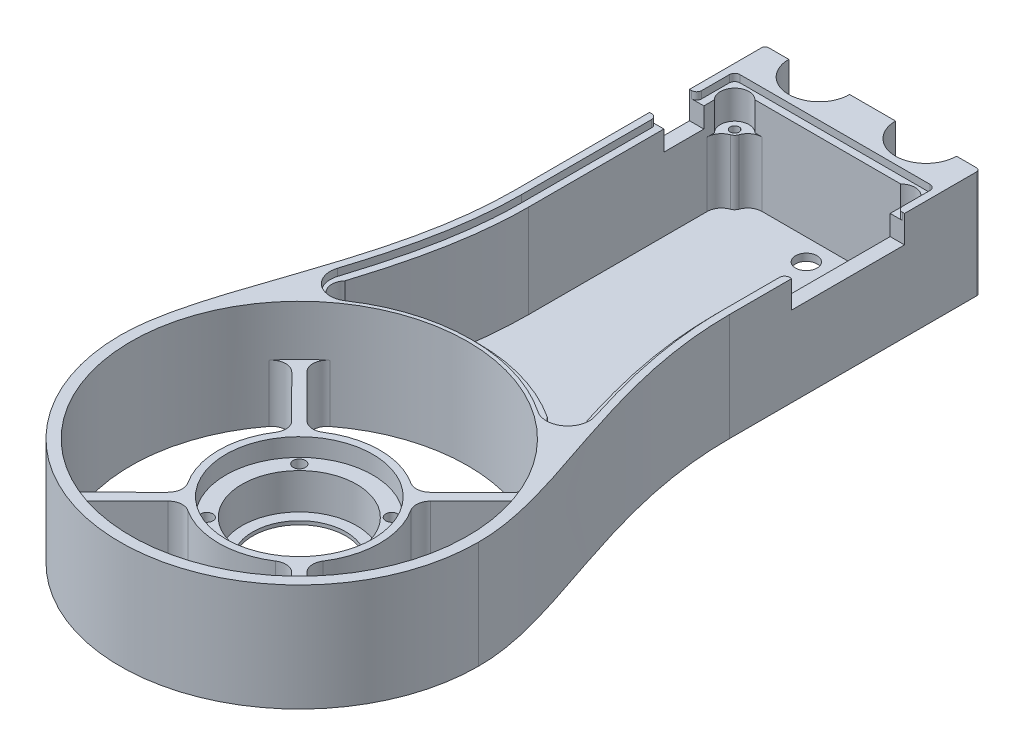
from build123d import *
from build123d.topology import SkipClean

# Parameters (mm, degrees)
EXTRUDE_1_DEPTH            = 30
CUT_EXTRUDE_1_DEPTH        = 209.327033807
SKETCH_3_R                 = 22.5
SKETCH_3_R_2               = 13
EXTRUDE_2_DEPTH            = 16
SKETCH_4_R                 = 20.5
CUT_EXTRUDE_2_DEPTH        = 5
SKETCH_5_R                 = 16
CUT_EXTRUDE_3_DEPTH        = 10
SKETCH_7_W                 = 1.7
SKETCH_7_H                 = 11
HOLE_WIZARD_M31_AT_2_COUNT = 2
HOLE_WIZARD_M31_AT_2_PITCH = 25.809397513
HOLE_WIZARD_M31_AT_3_COUNT = 2
HOLE_WIZARD_M31_AT_3_PITCH = 36.5
HOLE_WIZARD_M31_AT_4_COUNT = 2
HOLE_WIZARD_M31_AT_4_PITCH = 25.809397513
EXTRUDE_3_DEPTH            = 16
EXTRUDE_4_DEPTH            = 16
FILLET_1_R                 = 4
FILLET_2_R                 = 4
EXTRUDE_5_DEPTH            = 30
EXTRUDE_6_DEPTH            = 14
EXTRUDE_START              = -30
EXTRUDE_7_DEPTH            = 30
CUT_EXTRUDE_4_DEPTH        = 209.327033807
EXTRUDE_9_DEPTH            = 30
EXTRUDE_10_DEPTH           = 2
SKETCH_19_R                = 2.5
EXTRUDE_11_DEPTH           = 6
M3X0_51_D                  = 2.5
M3X0_51_DEPTH              = 5
M3X0_51_TIP                = 0.751075774
EXTRUDE_12_DEPTH           = 2
CUT_EXTRUDE_5_DEPTH        = 209.327033807
SKETCH_24_W                = 52
SKETCH_24_H                = 1.5
EXTRUDE_14_DEPTH           = 28
EXTRUDE_15_DEPTH           = 20
FILLET_3_R                 = 1
M4X0_71_D                  = 3.3
M4X0_71_DEPTH              = 11
M4X0_71_TIP                = 0.991420021
CUT_EXTRUDE_6_DEPTH        = 2
CUT_EXTRUDE_7_DEPTH        = 4
SKETCH_34_R                = 3
CUT_EXTRUDE_8_DEPTH        = 209.048439106
CUT_EXTRUDE_9_DEPTH        = 6
SKETCH_36_R                = 3
EXTRUDE_17_DEPTH           = 18
M3X0_52_D                  = 2.5
M3X0_52_DEPTH              = 8.5
M3X0_52_TIP                = 0.751075774
FILLET_4_R                 = 4
FILLET_START               = 1
FILLET_5_DEPTH             = 19
FILLET_6_R                 = 4
FILLET_7_DEPTH             = 19
FILLET_8_R                 = 4
SKETCH_39_R                = 3
CUT_EXTRUDE_10_DEPTH       = 209.048439106
CUT_EXTRUDE_12_DEPTH       = 2
FILLET_9_R                 = 1.5
CUT_EXTRUDE_13_REACH       = 210.327
SKETCH_44_W                = 11.16
SKETCH_44_H                = 7.6
FILLET_10_R                = 1.4
SKETCH_46_R                = 4
CUT_EXTRUDE_14_DEPTH       = 8


with BuildPart() as part:
    # Эскиз1 → Бобышка-Вытянуть1 (new body)
    with BuildSketch(Plane(origin=(0, 0, 0), x_dir=(1, 0, 0), z_dir=(0, 1, 0))):
        with BuildLine():
            Line((0, 0), (8.1, 0))
            ThreePointArc((8.1, 0), (15.1, -7), (22.1, 0))
            Line((22.1, 0), (37.9, 0))
            ThreePointArc((37.9, 0), (44.9, -7), (51.9, 0))
            Line((51.9, 0), (60, 0))
            Line((60, 0), (60, -50))
            add(Edge.make_bspline(
                [(60, -50), (60, -86.116353651), (80.160728995, -116.642608399), (80, -140)],
                knots=[0, 0, 0, 0, 1, 1, 1, 1], degree=3))
            ThreePointArc((80, -140), (30, -190), (-20, -140))
            add(Edge.make_bspline(
                [(0, -50), (0, -86.116353651), (-20.160728995, -116.642608399), (-20, -140)],
                knots=[0, 0, 0, 0, 1, 1, 1, 1], degree=3))
            Line((0, -50), (0, 0))
        make_face()
    extrude(amount=EXTRUDE_1_DEPTH)

    # Эскиз2 → Вырез-Вытянуть1 (cut, through all)
    with BuildSketch(Plane.XZ):
        with BuildLine():
            Line((3, 50), (3, 3))
            Line((3, 3), (5.560607986, 3))
            ThreePointArc((5.560607986, 3), (15.1, 10), (24.639392014, 3))
            Line((24.639392014, 3), (35.360607986, 3))
            ThreePointArc((35.360607986, 3), (44.9, 10), (54.439392014, 3))
            Line((54.439392014, 3), (57, 3))
            Line((57, 3), (57, 50))
            add(Edge.make_bspline(
                [(57, 50), (57, 51.157619484), (57.040607312, 53.481441414), (57.273709046, 58.05633088), (57.830062064, 63.685752057), (58.858254923, 70.27885976), (60.625878255, 78.854729592), (63.422502325, 89.162823296), (67.223452697, 100.856761308), (70.982787265, 111.851189123), (73.680425705, 120.399524986), (75.344386592, 126.838965256), (76.290218779, 131.460253347), (76.783421903, 135.123225854), (76.977758529, 137.948366969), (77.004903817, 139.304391304), (76.999998858, 139.989637546)],
                knots=[0, 0, 0, 0, 0.031254955, 0.062509911, 0.125019821, 0.187529732, 0.250039643, 0.375059464, 0.500079285, 0.625099107, 0.750118928, 0.812628839, 0.875138749, 0.93764866, 0.968903615, 1.000158571, 1.000158571, 1.000158571, 1.000158571], degree=3))
            ThreePointArc((76.999998858, 139.989637546), (30, 187), (-16.999998858, 139.989637546))
            add(Edge.make_bspline(
                [(-16.999998858, 139.989637546), (-17.004903817, 139.304391304), (-16.977758529, 137.948366969), (-16.783421903, 135.123225854), (-16.29021878, 131.460253347), (-15.344386592, 126.838965256), (-13.680425705, 120.399524986), (-10.982787266, 111.851189124), (-7.223452697, 100.856761308), (-3.422502325, 89.162823296), (-0.625878255, 78.854729592), (1.141745077, 70.27885976), (2.169937936, 63.685752057), (2.726290954, 58.05633088), (2.959392688, 53.481441414), (3, 51.157619484), (3, 50)],
                knots=[-0.000158571, -0.000158571, -0.000158571, -0.000158571, 0.031096385, 0.06235134, 0.124861251, 0.187371161, 0.249881072, 0.374900893, 0.499920715, 0.624940536, 0.749960357, 0.812470268, 0.874980179, 0.937490089, 0.968745045, 1, 1, 1, 1], degree=3))
        make_face()
    extrude(amount=-CUT_EXTRUDE_1_DEPTH, mode=Mode.SUBTRACT)

    # Эскиз9 → Бобышка-Вытянуть3 (add)
    with SkipClean():  # the faces are left unmerged after this step: merging them gives an invalid solid
        with BuildSketch(Plane.XZ):
            with BuildLine():
                ThreePointArc((-10.590299411, 110.803636994), (30, 89.99999981), (70.590299411, 110.803636994))
                add(Edge.make_bspline(
                    [(70.590299411, 110.803636994), (70.692739705, 111.112829984), (71.968212028, 114.973824728), (73.680425705, 120.399524986), (75.344386592, 126.838965256), (76.290218779, 131.460253347), (76.783421903, 135.123225854), (76.977758529, 137.948366969), (77.004903817, 139.304391304), (76.999998858, 139.989637546)],
                    knots=[0.614251023, 0.614251023, 0.614251023, 0.614251023, 0.625099107, 0.750118928, 0.812628839, 0.875138749, 0.93764866, 0.968903615, 1.000158571, 1.000158571, 1.000158571, 1.000158571], degree=3))
                ThreePointArc((76.999998858, 139.989637546), (30, 93), (-16.999998858, 139.989637546))
                add(Edge.make_bspline(
                    [(-16.999998858, 139.989637546), (-17.004903817, 139.304391304), (-16.977758529, 137.948366969), (-16.783421903, 135.123225854), (-16.29021878, 131.460253347), (-15.344386592, 126.838965256), (-13.680425705, 120.399524986), (-11.968212028, 114.973824728), (-10.692739705, 111.112829984), (-10.590299411, 110.803636994)],
                    knots=[-0.000158571, -0.000158571, -0.000158571, -0.000158571, 0.031096385, 0.06235134, 0.124861251, 0.187371161, 0.249881072, 0.374900893, 0.385748977, 0.385748977, 0.385748977, 0.385748977], degree=3))
            make_face()
        extrude(amount=-EXTRUDE_3_DEPTH)



with BuildPart() as body_2:
    # Эскиз3 → Бобышка-Вытянуть2 (new body)
    with BuildSketch(Plane.XZ):
        with Locations(Location((30, 140, 0), (0, 0, 270))):
            Circle(SKETCH_3_R)
        with Locations(Location((30, 140, 0), (0, 0, 270))):
            Circle(SKETCH_3_R_2, mode=Mode.SUBTRACT)
    extrude(amount=-EXTRUDE_2_DEPTH)

    # Эскиз4 → Вырез-Вытянуть2 (cut)
    with BuildSketch(Plane(origin=(0, 16, 0), x_dir=(1, 0, 0), z_dir=(0, 1, 0))):
        with Locations(Location((30, -140, 0), (0, 0, 270))):
            Circle(SKETCH_4_R)
    extrude(amount=-CUT_EXTRUDE_2_DEPTH, mode=Mode.SUBTRACT)

    # Эскиз5 → Вырез-Вытянуть3 (cut)
    with BuildSketch(Plane(origin=(0, 11, 0), x_dir=(1, 0, 0), z_dir=(0, 1, 0))):
        with Locations(Location((30, -140, 0), (0, 0, 270))):
            Circle(SKETCH_5_R)
    extrude(amount=-CUT_EXTRUDE_3_DEPTH, mode=Mode.SUBTRACT)

    # Эскиз7 → Отверстие с зазором M31 (revolve, cut)
    with BuildSketch(Plane(origin=(17.095301243, 11, 127.095301243), x_dir=(0, 0, 1), z_dir=(1, 0, 0))):
        with Locations((0.85, 5.5)):
            Rectangle(SKETCH_7_W, SKETCH_7_H)
    hole_wizard_m31 = revolve(axis=Axis((17.095301243, 17.35, 127.095301243), (0, -1, 0)), mode=Mode.SUBTRACT)

    # Отверстие с зазором M31 at 2: Отверстие с зазором M31 ×2
    with Locations(*[(i * HOLE_WIZARD_M31_AT_2_PITCH, 0, 0) for i in range(1, HOLE_WIZARD_M31_AT_2_COUNT)]):
        add(hole_wizard_m31, mode=Mode.SUBTRACT)

    # Отверстие с зазором M31 at 3: Отверстие с зазором M31 ×2
    with Locations(*[Vector(0.7071067811865477, 0, 0.7071067811865475) * (i * HOLE_WIZARD_M31_AT_3_PITCH) for i in range(1, HOLE_WIZARD_M31_AT_3_COUNT)]):
        add(hole_wizard_m31, mode=Mode.SUBTRACT)

    # Отверстие с зазором M31 at 4: Отверстие с зазором M31 ×2
    with Locations(*[(0, 0, i * HOLE_WIZARD_M31_AT_4_PITCH) for i in range(1, HOLE_WIZARD_M31_AT_4_COUNT)]):
        add(hole_wizard_m31, mode=Mode.SUBTRACT)


with BuildPart() as part_1:
    with SkipClean():  # the faces are left unmerged after this step: merging them gives an invalid solid
        add(part.part)

        add(body_2.part)  # Бобышка-Вытянуть4 merges body 2
        # Эскиз10 → Бобышка-Вытянуть4 (add)
        with BuildSketch(Plane.XZ):
            with BuildLine():
                Line((13.06156625, 154.810113507), (-4.284838091, 172.148870541))
                ThreePointArc((-4.284838091, 172.148870541), (-3.241274471, 173.226761376), (-2.163839457, 174.270795605))
                Line((-2.163839457, 174.270795605), (15.182490994, 156.931964648))
                ThreePointArc((15.182490994, 156.931964648), (14.086623923, 155.906428318), (13.06156625, 154.810113507))
            make_face()
            with BuildLine():
                Line((15.189886493, 123.06156625), (-2.148870541, 105.715161909))
                ThreePointArc((-2.148870541, 105.715161909), (-3.226761376, 106.758725529), (-4.270795605, 107.836160543))
                Line((-4.270795605, 107.836160543), (13.068035352, 125.182490994))
                ThreePointArc((13.068035352, 125.182490994), (14.093571682, 124.086623923), (15.189886493, 123.06156625))
            make_face()
            with BuildLine():
                Line((44.810113507, 156.93843375), (62.148870541, 174.284838091))
                ThreePointArc((62.148870541, 174.284838091), (63.226761376, 173.241274471), (64.270795605, 172.163839457))
                Line((64.270795605, 172.163839457), (46.931964648, 154.817509006))
                ThreePointArc((46.931964648, 154.817509006), (45.906428318, 155.913376077), (44.810113507, 156.93843375))
            make_face()
            with BuildLine():
                Line((46.93843375, 125.189886493), (64.284838091, 107.851129459))
                ThreePointArc((64.284838091, 107.851129459), (63.241274471, 106.773238624), (62.163839457, 105.729204395))
                Line((62.163839457, 105.729204395), (44.817509006, 123.068035352))
                ThreePointArc((44.817509006, 123.068035352), (45.913376077, 124.093571682), (46.93843375, 125.189886493))
            make_face()
        extrude(amount=-EXTRUDE_4_DEPTH)

    # Скругление1
    fillet_1_edges = [part_1.edges().sort_by_distance(p)[0] for p in [
        (70.590299411, 8, 110.803636994),
        (-10.590299411, 8, 110.803636994),
    ]]
    fillet(fillet_1_edges, radius=FILLET_1_R)

    # Скругление2
    fillet_2_edges = [part_1.edges().sort_by_distance(p)[0] for p in [
        (13.068035352, 8, 125.182490994),
        (-4.270795605, 8, 107.836160543),
        (13.06156625, 8, 154.810113507),
        (-4.284838091, 8, 172.148870541),
        (-2.163839457, 8, 174.270795605),
        (15.182490994, 8, 156.931964648),
        (44.810113507, 8, 156.93843375),
        (62.148870541, 8, 174.284838091),
        (46.931964648, 8, 154.817509006),
        (64.270795605, 8, 172.163839457),
        (46.93843375, 8, 125.189886493),
        (64.284838091, 8, 107.851129459),
        (44.817509006, 8, 123.068035352),
        (15.189886493, 8, 123.06156625),
        (-2.148870541, 8, 105.715161909),
        (62.163839457, 8, 105.729204395),
    ]]
    fillet(fillet_2_edges, radius=FILLET_2_R)

    # Эскиз11 → Бобышка-Вытянуть5 (add, through all)
    with BuildSketch(Plane(origin=(0, 30, 0), x_dir=(1, 0, 0), z_dir=(0, 1, 0))):
        with BuildLine():
            ThreePointArc((24.639392014, -3), (21.016079756, -8.062257768), (15.099999933, -10))
            Line((15.099999933, -10), (44.900000016, -10))
            ThreePointArc((44.900000016, -10), (38.983920224, -8.062257753), (35.360607986, -3))
            Line((35.360607986, -3), (24.639392014, -3))
        make_face()
        with BuildLine():
            ThreePointArc((54.439392014, -3), (50.81607979, -8.062257743), (44.900000016, -10))
            Line((44.900000016, -10), (57, -10))
            Line((57, -10), (57, -3))
            Line((57, -3), (54.439392014, -3))
        make_face()
        with BuildLine():
            Line((3, -3), (3, -10))
            Line((3, -10), (15.099999933, -10))
            ThreePointArc((15.099999933, -10), (9.18392019, -8.062257728), (5.560607986, -3))
            Line((5.560607986, -3), (3, -3))
        make_face()
    extrude(amount=-EXTRUDE_5_DEPTH)

    # Эскиз12 → Бобышка-Вытянуть6 (add)
    with SkipClean():  # the faces are left unmerged after this step: merging them gives an invalid solid
        with BuildSketch(Plane(origin=(0, 16, 0), x_dir=(1, 0, 0), z_dir=(0, 1, 0))):
            with BuildLine():
                ThreePointArc((59.169351437, -99.390284958), (30, -89.99999981), (0.830648563, -99.390284958))
                ThreePointArc((0.830648563, -99.390284958), (-3.85522263, -99.376716586), (-5.312887214, -94.923314864))
                add(Edge.make_bspline(
                    [(-5.312887214, -94.923314864), (-5.94223774, -96.891654802), (-7.843811242, -102.671041765), (-10.982787266, -111.851189124), (-13.680425705, -120.399524986), (-15.344386592, -126.838965256), (-16.29021878, -131.460253347), (-16.783421903, -135.123225854), (-16.977758529, -137.948366969), (-17.004903817, -139.304391304), (-16.999998858, -139.989637546)],
                    knots=[-0.000158571, -0.000158571, -0.000158571, -0.000158571, 0.062969621, 0.187989442, 0.313009264, 0.375519174, 0.438029085, 0.500538996, 0.531793951, 0.563048906, 0.563048906, 0.563048906, 0.563048906], degree=3))
                ThreePointArc((-16.999998858, -139.989637546), (30, -93), (76.999998858, -139.989637546))
                add(Edge.make_bspline(
                    [(76.999998858, -139.989637546), (77.004903817, -139.304391304), (76.977758529, -137.948366969), (76.783421903, -135.123225854), (76.290218779, -131.460253347), (75.344386592, -126.838965256), (73.680425705, -120.399524986), (70.982787265, -111.851189123), (67.843811241, -102.671041765), (65.94223774, -96.891654802), (65.312887214, -94.923314864)],
                    knots=[0.436951094, 0.436951094, 0.436951094, 0.436951094, 0.468206049, 0.499461004, 0.561970915, 0.624480826, 0.686990736, 0.812010558, 0.937030379, 1.000158571, 1.000158571, 1.000158571, 1.000158571], degree=3))
                ThreePointArc((65.312887214, -94.923314864), (63.85522263, -99.376716586), (59.169351437, -99.390284958))
            make_face()
        extrude(amount=EXTRUDE_6_DEPTH)
    add(part_1.part.scale(1), mode=Mode.REPLACE)  # the faces are merged on a copy

    # Эскиз13 → Бобышка-Вытянуть7 (add)
    with BuildSketch(Plane(origin=(0, 30, 0), x_dir=(1, 0, 0), z_dir=(0, 1, 0)).offset(EXTRUDE_START)):
        with BuildLine():
            Line((4, -50), (4, -11))
            Line((4, -11), (56, -11))
            Line((56, -11), (56, -50))
            add(Edge.make_bspline(
                [(56, -50), (56, -52.034980681), (56.125270586, -56.131935358), (56.819212399, -64.088500397), (58.410810449, -73.747778237), (60.678363501, -82.951847558), (62.737499644, -90.067621054), (63.80856927, -93.502002348), (64.360390296, -95.22786309)],
                knots=[0, 0, 0, 0, 0.054618887, 0.109237773, 0.218475547, 0.32771332, 0.382332207, 0.436951094, 0.436951094, 0.436951094, 0.436951094], degree=3))
            Line((64.360390296, -95.22786309), (65.166149164, -97.747933059))
            ThreePointArc((65.166149164, -97.747933059), (65.497512903, -96.349026708), (65.312887214, -94.923314864))
            add(Edge.make_bspline(
                [(57, -50), (57, -51.157619484), (57.040607312, -53.481441414), (57.273709046, -58.05633088), (57.830062064, -63.685752057), (58.858254923, -70.27885976), (60.625878255, -78.854729592), (62.85764527, -87.080813237), (64.695864475, -92.993530982), (65.312887214, -94.923314864)],
                knots=[0, 0, 0, 0, 0.031254955, 0.062509911, 0.125019821, 0.187529732, 0.250039643, 0.375059464, 0.436951094, 0.436951094, 0.436951094, 0.436951094], degree=3))
            Line((57, -50), (57, -10))
            Line((57, -10), (3, -10))
            Line((3, -10), (3, -50))
            add(Edge.make_bspline(
                [(-5.312887214, -94.923314864), (-4.695864475, -92.993530982), (-2.85764527, -87.080813237), (-0.625878255, -78.854729592), (1.141745077, -70.27885976), (2.169937936, -63.685752057), (2.726290954, -58.05633088), (2.959392688, -53.481441414), (3, -51.157619484), (3, -50)],
                knots=[0.563048906, 0.563048906, 0.563048906, 0.563048906, 0.624940536, 0.749960357, 0.812470268, 0.874980179, 0.937490089, 0.968745045, 1, 1, 1, 1], degree=3))
            ThreePointArc((-5.312887214, -94.923314864), (-5.497512903, -96.349026708), (-5.166149164, -97.747933059))
            Line((-5.166149164, -97.747933059), (-4.360390296, -95.22786309))
            add(Edge.make_bspline(
                [(-4.360390296, -95.22786309), (-3.80856927, -93.502002348), (-2.737499644, -90.067621054), (-0.678363501, -82.951847558), (1.589189551, -73.747778237), (3.180787601, -64.088500397), (3.874729414, -56.131935358), (4, -52.034980681), (4, -50)],
                knots=[0.563048906, 0.563048906, 0.563048906, 0.563048906, 0.617667793, 0.67228668, 0.781524453, 0.890762227, 0.945381113, 1, 1, 1, 1], degree=3))
        make_face()
    extrude(amount=EXTRUDE_7_DEPTH)

    # Эскиз14 → Вырез-Вытянуть4 (cut, through all)
    with BuildSketch(Plane(origin=(0, 30, 0), x_dir=(1, 0, 0), z_dir=(0, 1, 0))):
        with BuildLine():
            Line((4, -50), (56, -50))
            add(Edge.make_bspline(
                [(56, -50), (56, -52.034980681), (56.125270586, -56.131935358), (56.819212399, -64.088500397), (58.410810449, -73.747778237), (60.678363501, -82.951847558), (62.737499644, -90.067621054), (63.80856927, -93.502002348), (64.360390296, -95.22786309)],
                knots=[0, 0, 0, 0, 0.054618887, 0.109237773, 0.218475547, 0.32771332, 0.382332207, 0.436951094, 0.436951094, 0.436951094, 0.436951094], degree=3))
            Line((64.360390296, -95.22786309), (68.459948644, -108.049532565))
            ThreePointArc((68.459948644, -108.049532565), (30, -89.99999981), (-8.459948644, -108.049532565))
            Line((-8.459948644, -108.049532565), (-4.360390296, -95.22786309))
            add(Edge.make_bspline(
                [(-4.360390296, -95.22786309), (-3.80856927, -93.502002348), (-2.737499644, -90.067621054), (-0.678363501, -82.951847558), (1.589189551, -73.747778237), (3.180787601, -64.088500397), (3.874729414, -56.131935358), (4, -52.034980681), (4, -50)],
                knots=[0.563048906, 0.563048906, 0.563048906, 0.563048906, 0.617667793, 0.67228668, 0.781524453, 0.890762227, 0.945381113, 1, 1, 1, 1], degree=3))
        make_face()
    extrude(amount=-CUT_EXTRUDE_4_DEPTH, mode=Mode.SUBTRACT)

    # Эскиз15 → Бобышка-Вытянуть9 (add)
    with BuildSketch(Plane(origin=(0, 30, 0), x_dir=(1, 0, 0), z_dir=(0, 1, 0))):
        with BuildLine():
            Line((-4.360390296, -95.22786309), (-8.459948644, -108.049532565))
            ThreePointArc((-8.459948644, -108.049532565), (-3.531205401, -102.910132335), (2.077630415, -98.523002811))
            ThreePointArc((2.077630415, -98.523002811), (-2.535344593, -98.420348423), (-3.982504348, -94.039046676))
            add(Edge.make_bspline(
                [(-4.360390296, -95.22786309), (-4.233592317, -94.831293107), (-4.107654238, -94.435180898), (-3.982504348, -94.039046676)],
                knots=[0.563048906, 0.563048906, 0.563048906, 0.563048906, 0.575599288, 0.575599288, 0.575599288, 0.575599288], degree=3))
        make_face()
        with BuildLine():
            Line((68.459948644, -108.049532565), (64.360390296, -95.22786309))
            add(Edge.make_bspline(
                [(63.982538134, -94.03915362), (64.107676904, -94.43525219), (64.233603727, -94.831328794), (64.360390296, -95.22786309)],
                knots=[0.424401841, 0.424401841, 0.424401841, 0.424401841, 0.436951094, 0.436951094, 0.436951094, 0.436951094], degree=3))
            ThreePointArc((63.982538134, -94.03915362), (62.53530146, -98.420382479), (57.922370807, -98.523003634))
            ThreePointArc((57.922370807, -98.523003634), (63.531205947, -102.910132829), (68.459948644, -108.049532565))
        make_face()
    extrude(amount=-EXTRUDE_9_DEPTH)

    # Эскиз16 → Бобышка-Вытянуть10 (add)
    with BuildSketch(Plane.XZ):
        Polygon((-7.852464766, 101.935174027), (-2.068237999, 81.427460947), (2.401391775, 58.816392678), (2.401391775, 39.097437793), (2.401391775, 22.533515689), (2.401391775, 9.387545766), (57.351546055, 9.387545766), (57.351546055, 36.731163207), (57.351546055, 56.975956889), (62.609934024, 81.427460947), (67.020194902, 101.935174027), (62.609934024, 101.935174027), (57.351546055, 100.895725243), (53.104612881, 97.852307048), (47.493444526, 95.406397044), (40.928616834, 92.544786642), (34.931301468, 92.544786642), (28.840892836, 91.340868656), (21.733587887, 92.869321333), (13.415834781, 94.658085442), (5.092688812, 97.852307048), (-1.046943422, 101.935174027), align=None)
    extrude(amount=-EXTRUDE_10_DEPTH)

    # Эскиз19 → Бобышка-Вытянуть11 (add)
    with BuildSketch(Plane(origin=(0, 2, 0), x_dir=(1, 0, 0), z_dir=(0, 1, 0))):
        with Locations(Location((7.5, -18.5, 0), (0, 0, 90))):
            Circle(SKETCH_19_R)
        with Locations(Location((52.5, -18.5, 0), (0, 0, 90))):
            Circle(SKETCH_19_R)
        with Locations(Location((52.5, -63.5, 0), (0, 0, 90))):
            Circle(SKETCH_19_R)
        with Locations(Location((7.5, -63.5, 0), (0, 0, 90))):
            Circle(SKETCH_19_R)
    extrude(amount=EXTRUDE_11_DEPTH)

    # Отверстие обработанное метчиком M3x0.51
    with Locations(Plane(origin=(0, 8, 0), x_dir=(1, 0, 0), z_dir=(0, 1, 0))):
        with Locations((7.5, -18.5), (52.5, -18.5), (52.5, -63.5), (7.5, -63.5)):
            Hole(M3X0_51_D / 2, depth=M3X0_51_DEPTH)
            with Locations((0, 0, -(M3X0_51_DEPTH + M3X0_51_TIP / 2))):  # 118° drill point
                Cone(0, M3X0_51_D / 2, M3X0_51_TIP, mode=Mode.SUBTRACT)

    # Эскиз22 → Бобышка-Вытянуть12 (add)
    with BuildSketch(Plane(origin=(0, 2, 0), x_dir=(1, 0, 0), z_dir=(0, 1, 0))):
        with BuildLine():
            ThreePointArc((9.974873734, -18.853553391), (9.267766953, -20.267766953), (7.853553391, -20.974873734))
            Line((7.853553391, -20.974873734), (27.878679656, -41))
            Line((27.878679656, -41), (7.853553391, -61.025126266))
            ThreePointArc((7.853553391, -61.025126266), (9.267766953, -61.732233047), (9.974873734, -63.146446609))
            Line((9.974873734, -63.146446609), (30, -43.121320344))
            Line((30, -43.121320344), (50.025126266, -63.146446609))
            ThreePointArc((50.025126266, -63.146446609), (50.732233047, -61.732233047), (52.146446609, -61.025126266))
            Line((52.146446609, -61.025126266), (32.121320344, -41))
            Line((32.121320344, -41), (52.146446609, -20.974873734))
            ThreePointArc((52.146446609, -20.974873734), (50.732233047, -20.267766953), (50.025126266, -18.853553391))
            Line((50.025126266, -18.853553391), (30, -38.878679656))
            Line((30, -38.878679656), (9.974873734, -18.853553391))
        make_face()
        with BuildLine():
            Line((4, -20), (5.5, -20))
            ThreePointArc((5.5, -20), (5, -18.5), (5.5, -17))
            Line((5.5, -17), (4, -17))
            Line((4, -17), (4, -20))
        make_face()
        with BuildLine():
            ThreePointArc((5.5, -65), (5, -63.5), (5.5, -62))
            Line((5.5, -62), (3.315002208, -62))
            add(Edge.make_bspline(
                [(2.940902429, -65), (3.073908034, -64.031610352), (3.199237612, -63.031667865), (3.31200872, -62.026758174), (3.315002208, -62)],
                knots=[0.863646764, 0.863646764, 0.863646764, 0.863646764, 0.890762227, 0.891503892, 0.891503892, 0.891503892, 0.891503892], degree=3))
            Line((2.940902429, -65), (5.5, -65))
        make_face()
        with BuildLine():
            Line((56, -17), (54.5, -17))
            ThreePointArc((54.5, -17), (55, -18.5), (54.5, -20))
            Line((54.5, -20), (56, -20))
            Line((56, -20), (56, -17))
        make_face()
        with BuildLine():
            ThreePointArc((54.5, -62), (55, -63.5), (54.5, -65))
            Line((54.5, -65), (57.059097571, -65))
            add(Edge.make_bspline(
                [(56.684997792, -62), (56.68799128, -62.026758174), (56.800762388, -63.031667865), (56.926091965, -64.031610352), (57.059097571, -65)],
                knots=[0.108496108, 0.108496108, 0.108496108, 0.108496108, 0.109237773, 0.136353236, 0.136353236, 0.136353236, 0.136353236], degree=3))
            Line((56.684997792, -62), (54.5, -62))
        make_face()
    extrude(amount=EXTRUDE_12_DEPTH)

    # Эскиз23 → Вырез-Вытянуть5 (cut, through all)
    with BuildSketch(Plane(origin=(0, 30, 0), x_dir=(1, 0, 0), z_dir=(0, 1, 0))):
        with BuildLine():
            Line((8.1, 0), (6.6, 0))
            ThreePointArc((6.6, 0), (15.1, -8.5), (23.6, 0))
            Line((23.6, 0), (22.1, 0))
            ThreePointArc((22.1, 0), (15.1, -7), (8.1, 0))
        make_face()
        with BuildLine():
            Line((53.4, 0), (51.9, 0))
            ThreePointArc((51.9, 0), (44.9, -7), (37.9, 0))
            Line((37.9, 0), (36.4, 0))
            ThreePointArc((36.4, 0), (44.9, -8.5), (53.4, 0))
        make_face()
    extrude(amount=-CUT_EXTRUDE_5_DEPTH, mode=Mode.SUBTRACT)

    # Эскиз24 → Бобышка-Вытянуть14 (add)
    with BuildSketch(Plane(origin=(0, 2, 0), x_dir=(1, 0, 0), z_dir=(0, 1, 0))):
        with Locations((30, -11.75)):
            Rectangle(SKETCH_24_W, SKETCH_24_H)
    extrude(amount=EXTRUDE_14_DEPTH)


with BuildPart() as body_2_2:
    # Split Bodies 1: the piece on the far side of the plane
    add(part_1.part)
    split(bisect_by=Plane(origin=(0, 0, 41.123183465), x_dir=(-1, 0, 0), z_dir=(0, 0, -1)), keep=Keep.BOTTOM)


with BuildPart() as part_2:
    add(part_1.part)

    # Split Bodies 1
    split(bisect_by=Plane(origin=(0, 0, 41.123183465), x_dir=(-1, 0, 0), z_dir=(0, 0, -1)), keep=Keep.TOP)


with BuildPart() as part_3:
    # Move Body 1: read off the stored shape, not the designer's step
    # Move Body 1: moved
    add(part_2.part.moved(Location((0, 0, -20))))


    add(body_2_2.part)  # Бобышка-Вытянуть15 merges body 2 2
    # Эскиз27 → Бобышка-Вытянуть15 (add)
    with BuildSketch(Plane(origin=(0, 0, 41.123183465), x_dir=(-1, 0, 0), z_dir=(0, 0, -1))):
        Polygon((-60, 0), (0, 0), (0, 30), (-4, 30), (-4, 2), (-56, 2), (-56, 30), (-60, 30), align=None)
    extrude(amount=EXTRUDE_15_DEPTH)

    # Скругление3
    fillet_3_edges = [part_3.edges().sort_by_distance(p)[0] for p in [
        (0, 15, -20),
        (60, 15, -20),
    ]]
    fillet(fillet_3_edges, radius=FILLET_3_R)

    # Отверстие обработанное метчиком M4x0.71
    with Locations(Plane(origin=(0, 0, -20), x_dir=(-1, 0, 0), z_dir=(0, 0, -1))):
        with Locations((-55.75, 25), (-30, 25), (-4.25, 25), (-4.25, 5), (-30, 5), (-55.75, 5)):
            Hole(M4X0_71_D / 2, depth=M4X0_71_DEPTH)
            with Locations((0, 0, -(M4X0_71_DEPTH + M4X0_71_TIP / 2))):  # 118° drill point
                Cone(0, M4X0_71_D / 2, M4X0_71_TIP, mode=Mode.SUBTRACT)

    # Эскиз31 → Вырез-Вытянуть6 (cut)
    with BuildSketch(Plane(origin=(0, 30, 0), x_dir=(1, 0, 0), z_dir=(0, 1, 0))):
        with BuildLine():
            Line((58, -50), (58, 9.5))
            Line((58, 9.5), (2, 9.5))
            Line((2, 9.5), (2, -50))
            add(Edge.make_bspline(
                [(2, -50), (2, -53.699300475), (1.793050573, -57.386405136), (1.211129131, -62.901062421), (0.97232817, -64.735113189), (0.414928411, -68.387396341), (0.096175926, -70.206931321), (-0.612795733, -73.834212995), (-1.003172031, -75.642278607), (-1.844400633, -79.239733159), (-2.295455623, -81.030251086), (-3.724777276, -86.381266668), (-4.779021803, -89.921274352), (-5.892373376, -93.445341845)],
                knots=[0, 0, 0, 0, 0.25, 0.25, 0.375, 0.375, 0.5, 0.5, 0.625, 0.625, 0.75, 0.75, 1, 1, 1, 1], degree=3))
            ThreePointArc((-5.892373376, -93.445341845), (-3.729477768, -100.024738414), (3.194525369, -100.182082575))
            ThreePointArc((3.194525369, -100.182082575), (30.000000812, -91.99999981), (56.805475979, -100.182083482))
            ThreePointArc((56.805475979, -100.182083482), (63.729424876, -100.02477977), (65.892414554, -93.445472173))
            add(Edge.make_bspline(
                [(65.892414554, -93.445472173), (64.778275492, -89.918916093), (63.722933797, -86.375258803), (61.814584417, -79.229095389), (60.963396016, -75.630590785), (59.900229344, -70.187221308), (59.581220007, -68.364321505), (59.024766004, -64.71388467), (58.786982896, -62.884890165), (58.207211576, -57.385434994), (58, -53.702390763), (58, -50)],
                knots=[0, 0, 0, 0, 0.25, 0.25, 0.5, 0.5, 0.625, 0.625, 0.75, 0.75, 1, 1, 1, 1], degree=3))
        make_face()
    extrude(amount=-CUT_EXTRUDE_6_DEPTH, mode=Mode.SUBTRACT)

    # Эскиз33 → Вырез-Вытянуть7 (cut)
    with BuildSketch(Plane(origin=(60, 0, 0), x_dir=(0, 0, -1), z_dir=(1, 0, 0))):
        Polygon((-24.96, 30), (-32.58, 30), (-32.58, 25.44), (-32.58, 22.4), (-29.54, 22.4), (-24.96, 22.4), (-21.92, 22.4), (-19.38, 22.4), (-16.84, 22.4), (-14.3, 22.4), (-11.76, 22.4), (-9.22, 22.4), (-6.68, 22.4), (-4.14, 22.4), (-1.1, 22.4), (-1.1, 25.44), (-1.1, 30), align=None)
    extrude(amount=-CUT_EXTRUDE_7_DEPTH, mode=Mode.SUBTRACT)

    # Эскиз34 → Вырез-Вытянуть8 (cut, through all)
    with BuildSketch(Plane(origin=(0, 2, 0), x_dir=(1, 0, 0), z_dir=(0, 1, 0))):
        with Locations(Location((5.178106811, -89.227815171, 0), (0, 0, 270))):
            Circle(SKETCH_34_R)
        with Locations(Location((54.821893189, -89.227815171, 0), (0, 0, 90))):
            Circle(SKETCH_34_R)
    extrude(amount=-CUT_EXTRUDE_8_DEPTH, mode=Mode.SUBTRACT)

    # Эскиз35 → Вырез-Вытянуть9 (cut)
    with BuildSketch(Plane(origin=(0, 8, 0), x_dir=(1, 0, 0), z_dir=(0, 1, 0))):
        with BuildLine():
            Line((4, 7.5), (56, 7.5))
            Line((56, 7.5), (56, -50))
            add(Edge.make_bspline(
                [(57.382839337, -67.210838592), (57.119444295, -65.516112065), (56.624169486, -61.852186644), (56.125270586, -56.131935358), (56, -52.034980681), (56, -50)],
                knots=[0.267332174, 0.267332174, 0.267332174, 0.267332174, 0.315164068, 0.369782955, 0.424401841, 0.424401841, 0.424401841, 0.424401841], degree=3))
            Line((57.382839337, -67.210838592), (2.617160663, -67.210838592))
            add(Edge.make_bspline(
                [(4, -50), (4, -52.034980681), (3.874729414, -56.131935358), (3.375830514, -61.852186644), (2.880555705, -65.516112065), (2.617160663, -67.210838592)],
                knots=[0.575599288, 0.575599288, 0.575599288, 0.575599288, 0.630218175, 0.684837061, 0.732668956, 0.732668956, 0.732668956, 0.732668956], degree=3))
            Line((4, -50), (4, 7.5))
        make_face()
    extrude(amount=-CUT_EXTRUDE_9_DEPTH, mode=Mode.SUBTRACT)

    # Эскиз36 → Бобышка-Вытянуть17 (add)
    with BuildSketch(Plane(origin=(0, 2, 0), x_dir=(1, 0, 0), z_dir=(0, 1, 0))):
        with Locations((-0.811267397, -96.088490424)):
            Circle(SKETCH_36_R)
        with Locations((60.811267397, -96.088490424)):
            Circle(SKETCH_36_R)
        with BuildLine():
            Line((4, 7.5), (6, 7.5))
            ThreePointArc((6, 7.5), (7.414213562, 4.085786438), (4, 5.5))
            Line((4, 5.5), (4, 7.5))
        make_face()
        with BuildLine():
            Line((56, 7.5), (54, 7.5))
            ThreePointArc((54, 7.5), (52.585786438, 4.085786438), (56, 5.5))
            Line((56, 5.5), (56, 7.5))
        make_face()
    extrude(amount=EXTRUDE_17_DEPTH)

    # Отверстие обработанное метчиком M3x0.52
    with Locations(Plane(origin=(0, 20, 0), x_dir=(1, 0, 0), z_dir=(0, 1, 0))):
        with Locations((-0.811267397, -96.088490424), (60.811267397, -96.088490424), (54, 5.5), (6, 5.5)):
            Hole(M3X0_52_D / 2, depth=M3X0_52_DEPTH)
            with Locations((0, 0, -(M3X0_52_DEPTH + M3X0_52_TIP / 2))):  # 118° drill point
                Cone(0, M3X0_52_D / 2, M3X0_52_TIP, mode=Mode.SUBTRACT)

    # Скругление4
    # the kernel refuses this fillet: 4 mm, written as the material it adds along each edge
    with BuildSketch(Plane(origin=(61.221909136, 2, 99.060253094), x_dir=(-0.9225636556466345, 0, -0.38584491869132853), z_dir=(0, 1, 0))) as fillet_4_piece_1:
        with BuildLine():
            CenterArc((8.383622748, -3.98530699), FILLET_4_R, 85.087573596, 83.357833532)
            Line((4.46468556, -3.184100826), (4.072791842, -3.10398021))
            ThreePointArc((4.072791842, -3.10398021), (3.035144293, -0.466377415), (0.203397689, -0.34442616))
            Line((0.203397689, -0.34442616), (-0.247081102, 0.314564666))
            ThreePointArc((-0.247081102, 0.314564666), (3.329380927, 1.169774266), (8.760407993, 0.398530699))
            Line((8.760407993, 0.398530699), (8.726154789, 0))
        make_face()
    extrude(amount=18)

    # Скругление5: read off the stored shape, not the designer's step
    # Скругление5 outline → Скругление5 (add)
    with BuildSketch(Plane(origin=(0, 0, 0), x_dir=(1, 0, 0), z_dir=(0, 1, 0)).offset(FILLET_START)):
        with BuildLine():
            ThreePointArc((62.257648237, -88.384981), (61.988127997, -91.316026108), (59.786050251, -93.269105775))
            ThreePointArc((59.786050251, -93.269105775), (63.01921188, -94.05748546), (63.535405422, -97.34510175))
            ThreePointArc((63.535405422, -97.34510175), (64.12006922, -95.740966466), (63.982538134, -94.03915362))
            add(Edge.make_bspline(
                [(62.257648237, -88.384981), (62.419832764, -88.938389353), (62.98533962, -90.842963809), (63.563027697, -92.711287886), (63.982538134, -94.03915362)],
                knots=[0.36522033, 0.36522033, 0.36522033, 0.36522033, 0.382332207, 0.424401841, 0.424401841, 0.424401841, 0.424401841], degree=3))
        make_face()
    extrude(amount=FILLET_5_DEPTH)

    # Скругление6
    # the kernel refuses this fillet: 4 mm, written as the material it adds along each edge
    with BuildSketch(Plane(origin=(-1.221898724, -19.815364345, 99.060254532), x_dir=(0.9225634193110782, 0, -0.38584548377433653), z_dir=(0, 1, 0))) as fillet_6_piece_1_section:
        with BuildLine():
            CenterArc((8.383616139, 3.985307199), FILLET_6_R, 191.554557777, 83.357833532)
            Line((4.46467846, 3.184103436), (4.072784692, 3.10398306))
            ThreePointArc((4.072784692, 3.10398306), (3.035139236, 0.466383546), (0.203396693, 0.344426749))
            Line((0.203396693, 0.344426749), (-0.247080569, -0.314565084))
            ThreePointArc((-0.247080569, -0.314565084), (3.329372592, -1.169770675), (8.760398698, -0.39853072))
            Line((8.760398698, -0.39853072), (8.726145738, 0))
        make_face()
    fillet_6_piece_1 = extrude(amount=39.815364345, mode=Mode.PRIVATE)
    fillet_6_piece_1 = split(fillet_6_piece_1, bisect_by=Plane(origin=(-1.221898724, 0, 99.060254532), z_dir=(0, 1, 0)), keep=Keep.TOP, mode=Mode.PRIVATE)
    add(fillet_6_piece_1)

    # Скругление7: read off the stored shape, not the designer's step
    # Скругление7 outline → Скругление7 (add)
    with BuildSketch(Plane(origin=(0, 0, 0), x_dir=(1, 0, 0), z_dir=(0, 1, 0)).offset(FILLET_START)):
        with BuildLine():
            ThreePointArc((0.213949749, -93.269105775), (-1.988127997, -91.316026108), (-2.257648237, -88.384981))
            add(Edge.make_bspline(
                [(-3.982504348, -94.039046676), (-3.563005648, -92.711216577), (-2.985328828, -90.842927463), (-2.419832764, -88.938389353), (-2.257648237, -88.384981)],
                knots=[0.575599288, 0.575599288, 0.575599288, 0.575599288, 0.617667793, 0.63477967, 0.63477967, 0.63477967, 0.63477967], degree=3))
            ThreePointArc((-3.982504348, -94.039046676), (-4.12007604, -95.740903809), (-3.535411218, -97.345089184))
            ThreePointArc((-3.535411218, -97.345089184), (-3.019207195, -94.057480368), (0.213949749, -93.269105775))
        make_face()
    extrude(amount=FILLET_7_DEPTH)

    # Скругление8
    fillet_8_edges = [part_3.edges().sort_by_distance(p)[0] for p in [
        (4, 11, -5.5),
        (6, 11, -7.5),
        (54, 11, -7.5),
    ]]
    fillet(fillet_8_edges, radius=FILLET_8_R)
    fillet_8_2_edges = [part_3.edges().sort_by_distance(p)[0] for p in [
        (56, 11, -5.5),
    ]]
    fillet(fillet_8_2_edges, radius=FILLET_8_R)

    # Эскиз39 → Вырез-Вытянуть10 (cut, through all)
    with BuildSketch(Plane(origin=(0, 2, 0), x_dir=(1, 0, 0), z_dir=(0, 1, 0))):
        with Locations(Location((30, 1.5, 0), (0, 0, 270))):
            Circle(SKETCH_39_R)
    extrude(amount=-CUT_EXTRUDE_10_DEPTH, mode=Mode.SUBTRACT)

    # Эскиз42 → Вырез-Вытянуть12 (cut)
    with BuildSketch(Plane(origin=(0, 30, 0), x_dir=(1, 0, 0), z_dir=(0, 1, 0))):
        with BuildLine():
            Line((58, -1.1), (58, 0.3))
            ThreePointArc((58, 0.3), (58.410050506, -0.689949494), (59.4, -1.1))
            Line((59.4, -1.1), (58, -1.1))
        make_face()
        with BuildLine():
            Line((58, -32.58), (59.4, -32.58))
            ThreePointArc((59.4, -32.58), (58.410050506, -32.990050506), (58, -33.98))
            Line((58, -33.98), (58, -32.58))
        make_face()
    extrude(amount=-CUT_EXTRUDE_12_DEPTH, mode=Mode.SUBTRACT)

    # Скругление9
    fillet_9_edges = [part_3.edges().sort_by_distance(p)[0] for p in [
        (2, 29, -9.5),
        (58, 29, -9.5),
    ]]
    fillet(fillet_9_edges, radius=FILLET_9_R)

    # Вырез-Вытянуть13: up to this face of the body (flat: up to its plane)
    cut_extrude_13_end = Plane(part_3.part.faces().sort_by_distance((4, 15.406206161, 23.780824111))[0])
    # Эскиз44 → Вырез-Вытянуть13 (cut, up to the picked face)
    with BuildSketch(Plane.ZY, mode=Mode.PRIVATE) as cut_extrude_13_sk1:
        with Locations((6.68, 26.2)):
            Rectangle(SKETCH_44_W, SKETCH_44_H)
    cut_extrude_13_tool1 = split(extrude(cut_extrude_13_sk1.sketch, amount=-CUT_EXTRUDE_13_REACH, mode=Mode.PRIVATE), bisect_by=cut_extrude_13_end, keep=Keep.BOTH, mode=Mode.PRIVATE)
    add(cut_extrude_13_tool1.solids().sort_by(Axis((0, 26.2, 6.68), (1, 0, 0)))[0], mode=Mode.SUBTRACT)

    # Скругление10
    fillet_10_edges = [part_3.edges().sort_by_distance(p)[0] for p in [
        (2, 29, 12.26),
        (2, 29, 1.1),
    ]]
    fillet(fillet_10_edges, radius=FILLET_10_R)

    # Эскиз46 → Вырез-Вытянуть14 (cut)
    with BuildSketch(Plane(origin=(0, 28, 0), x_dir=(1, 0, 0), z_dir=(0, 1, 0))):
        with Locations((6.828427125, 4.671572875)):
            Circle(SKETCH_46_R)
        with Locations((53.171572875, 4.671572875)):
            Circle(SKETCH_46_R)
        with Locations((-0.811267397, -96.088490424)):
            Circle(SKETCH_46_R)
        with Locations((60.811267397, -96.088490424)):
            Circle(SKETCH_46_R)
    extrude(amount=-CUT_EXTRUDE_14_DEPTH, mode=Mode.SUBTRACT)


solid = part_3.part
